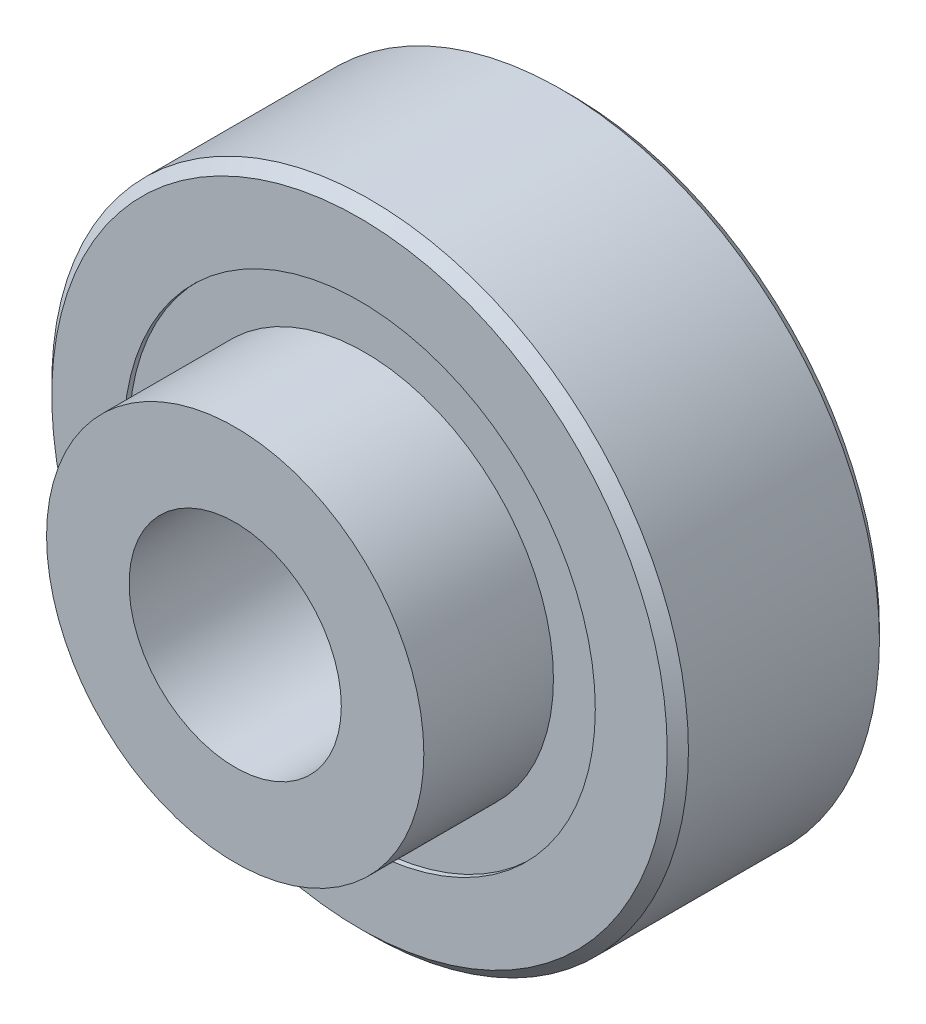
from build123d import *

# Parameters (mm, degrees)
COVER_1_SKETCH_W = 1.585836018
COVER_1_SKETCH_H = 1.555555556
COVER_2_SKETCH_W = 1.585836018
COVER_2_SKETCH_H = 1.555555556


with BuildPart() as part:
    # Outter Chase Sketch → Outter Chase Revolve (revolve)
    with BuildSketch(Plane(origin=(0, 0, 0), x_dir=(0, 0, -1), z_dir=(1, 0, 0))):
        with BuildLine():
            Line((3.15, 10.5), (-3.15, 10.5))
            Line((-3.15, 10.5), (-3.5, 10.15))
            Line((-3.5, 10.15), (-3.5, 7.777777778))
            Line((-3.5, 7.777777778), (-1.555555556, 7.777777778))
            ThreePointArc((-1.555555556, 7.777777778), (0, 8.739163982), (1.555555556, 7.777777778))
            Line((1.555555556, 7.777777778), (3.5, 7.777777778))
            Line((3.5, 7.777777778), (3.5, 10.15))
            Line((3.5, 10.15), (3.15, 10.5))
        make_face()
    revolve(axis=Axis((0, 0, 3.5), (0, 0, -1)))


with BuildPart() as body_2:
    # Inner Chase Sketch → Inner Chase Revolve (revolve)
    with BuildSketch(Plane(origin=(0, 0, 0), x_dir=(0, 0, -1), z_dir=(1, 0, 0))):
        with BuildLine():
            Line((-3.5, 6.222222222), (-1.555555556, 6.222222222))
            ThreePointArc((-1.555555556, 6.222222222), (0, 5.260836018), (1.555555556, 6.222222222))
            Line((1.555555556, 6.222222222), (3.5, 6.222222222))
            Line((3.5, 6.222222222), (3.5, 3.85))
            Line((3.5, 3.85), (3.15, 3.5))
            Line((3.15, 3.5), (-3.15, 3.5))
            Line((-3.15, 3.5), (-3.5, 3.85))
            Line((-3.5, 3.85), (-3.5, 6.222222222))
        make_face()
    revolve(axis=Axis((0, 0, 3.5), (0, 0, -1)))

    # Flange Sketch → Flange Revolve (revolve)
    with BuildSketch(Plane(origin=(0, 0, 0), x_dir=(0, 0, -1), z_dir=(1, 0, 0))):
        Polygon((-3.15, 3.5), (-3.5, 3.85), (-3.5, 6.222222222), (-7.6, 6.222222222), (-7.6, 3.5), align=None)
    revolve(axis=Axis((0, 0, 3.5), (0, 0, -1)))


with BuildPart() as body_3:
    # Cover 1 Sketch → Cover 1 Revolve (revolve)
    with BuildSketch(Plane(origin=(0, 0, 0), x_dir=(0, 0, -1), z_dir=(1, 0, 0))):
        with Locations((-2.532081991, 7)):
            Rectangle(COVER_1_SKETCH_W, COVER_1_SKETCH_H)
    revolve(axis=Axis((0, 0, 3.5), (0, 0, -1)))


with BuildPart() as body_4:
    # Cover 2 Sketch → Cover 2 Revolve (revolve)
    with BuildSketch(Plane(origin=(0, 0, 0), x_dir=(0, 0, -1), z_dir=(1, 0, 0))):
        with Locations((2.532081991, 7)):
            Rectangle(COVER_2_SKETCH_W, COVER_2_SKETCH_H)
    revolve(axis=Axis((0, 0, 3.5), (0, 0, -1)))


solid = Compound([part.part, body_2.part, body_3.part, body_4.part])
